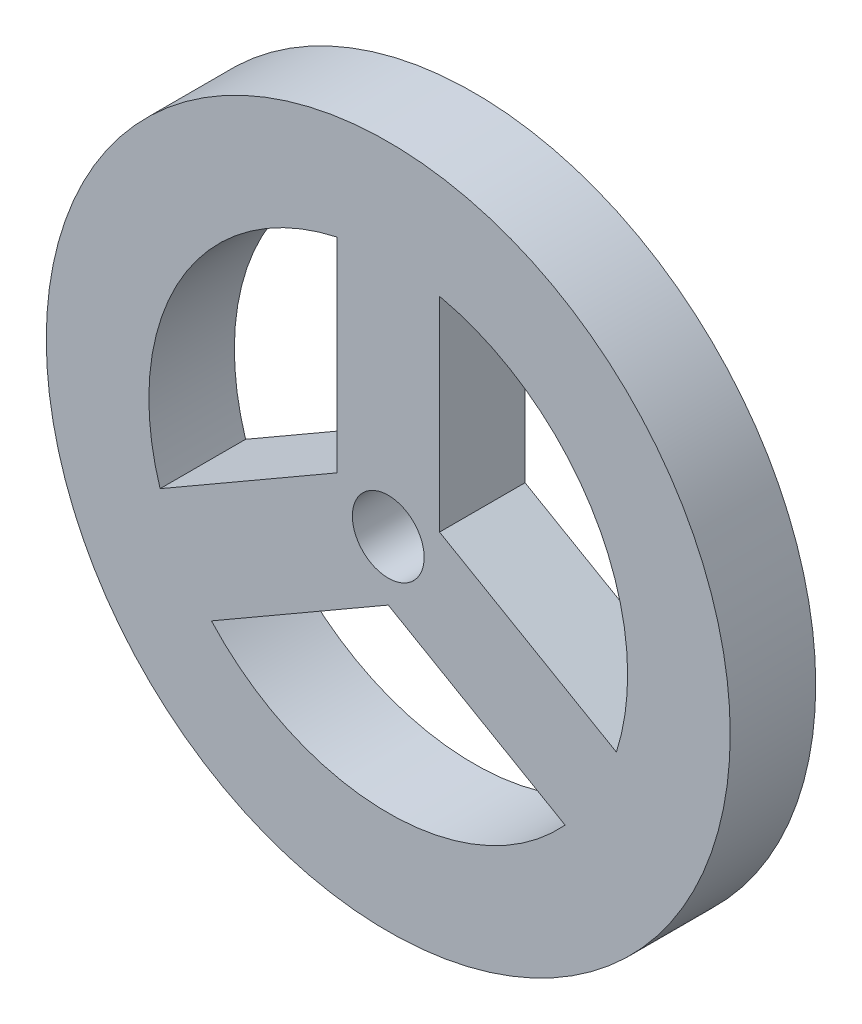
from build123d import *

# Parameters (mm, degrees)
SKETCH1_R           = 25.4
SKETCH1_R_2         = 2.667
BOSS_EXTRUDE3_DEPTH = 6.35


with BuildPart() as part:
    # Sketch1 → Boss-Extrude3 (new body)
    with BuildSketch(Plane.XY):
        Circle(SKETCH1_R)
        Circle(SKETCH1_R_2, mode=Mode.SUBTRACT)
        with BuildLine():
            Line((-13.135253489, -11.983051189), (0, -4.399409051))
            Line((0, -4.399409051), (13.135253489, -11.983051189))
            ThreePointArc((13.135253489, -11.983051189), (0, -17.78), (-13.135253489, -11.983051189))
        make_face(mode=Mode.SUBTRACT)
        with BuildLine():
            Line((-3.81, 17.366988801), (-3.81, 2.199704526))
            Line((-3.81, 2.199704526), (-16.945253489, -5.383937612))
            ThreePointArc((-16.945253489, -5.383937612), (-15.397931679, 8.89), (-3.81, 17.366988801))
        make_face(mode=Mode.SUBTRACT)
        with BuildLine():
            Line((16.945253489, -5.383937612), (3.81, 2.199704526))
            Line((3.81, 2.199704526), (3.81, 17.366988801))
            ThreePointArc((3.81, 17.366988801), (15.397931679, 8.89), (16.945253489, -5.383937612))
        make_face(mode=Mode.SUBTRACT)
    extrude(amount=BOSS_EXTRUDE3_DEPTH)


solid = part.part
